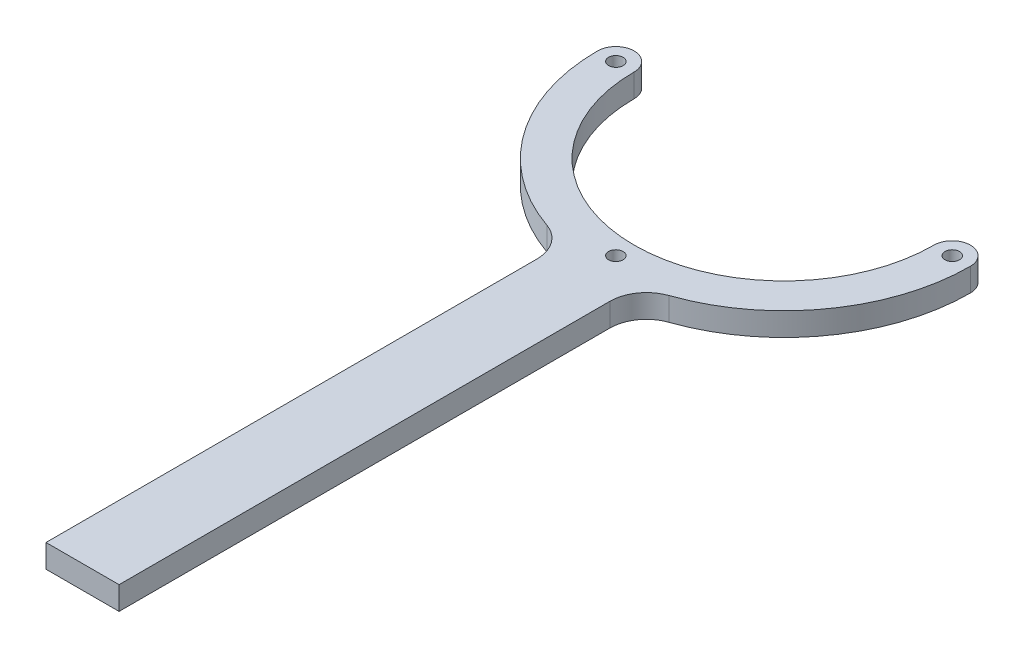
from build123d import *

# Parameters (mm, degrees)
SKETCH1_R           = 1.984375
BOSS_EXTRUDE1_DEPTH = 6.35
FILLET1_R           = 10


with BuildPart() as part:
    # Sketch1 → Boss-Extrude1 (new body)
    with BuildSketch(Plane(origin=(0, 0, 0), x_dir=(1, 0, 0), z_dir=(0, 1, 0))):
        with BuildLine():
            ThreePointArc((-41.032792877, 96), (-46.032792877, 101), (-51.032792877, 96))
            ThreePointArc((-51.032792877, 96), (-39.46310858, 63.642481399), (-10, 45.956559383))
            Line((-10, 45.956559383), (-10, -96))
            Line((-10, -96), (10, -96))
            Line((10, -96), (10, 45.956559383))
            ThreePointArc((10, 45.956559383), (39.46310858, 63.642481399), (51.032792877, 96))
            ThreePointArc((51.032792877, 96), (46.032792877, 101), (41.032792877, 96))
            ThreePointArc((41.032792877, 96), (0, 54.967207123), (-41.032792877, 96))
        make_face()
        with Locations((0, 49.967207123)):
            Circle(SKETCH1_R, mode=Mode.SUBTRACT)
        with Locations((46.032792877, 96)):
            Circle(SKETCH1_R, mode=Mode.SUBTRACT)
        with Locations((-46.032792877, 96)):
            Circle(SKETCH1_R, mode=Mode.SUBTRACT)
    extrude(amount=BOSS_EXTRUDE1_DEPTH)

    # Fillet1
    fillet1_edges = [part.edges().sort_by_distance(p)[0] for p in [
        (10, 3.175, -45.956559383),
        (-10, 3.175, -45.956559383),
    ]]
    fillet(fillet1_edges, radius=FILLET1_R)


solid = part.part
